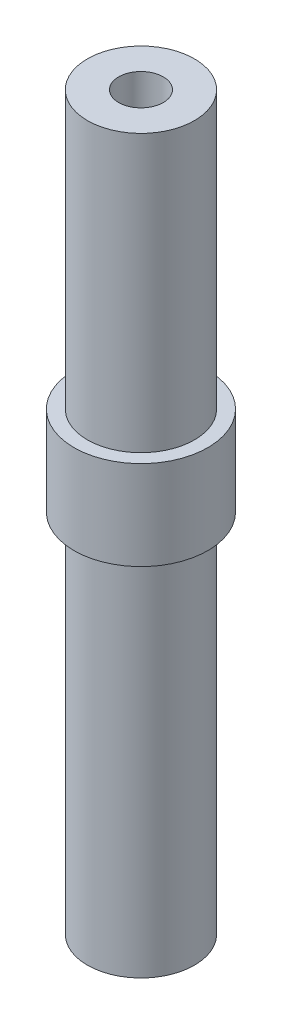
from build123d import *

# Parameters (mm, degrees)
BOSS_EXTRUDE1_DEPTH      = 20.5
BOSS_EXTRUDE1_DEPTH_BACK = 20.5
SKETCH1_R                = 3
SKETCH6_R                = 3.75
BOSS_EXTRUDE2_DEPTH      = 5


with BuildPart() as part:
    # Sketch1 → Boss-Extrude1 (new, two sides: drawn at the far end of the back side and taken through both)
    with BuildSketch(Plane(origin=(0, 0, 0), x_dir=(1, 0, 0), z_dir=(0, 1, 0)).offset(-BOSS_EXTRUDE1_DEPTH_BACK)):
        Circle(SKETCH1_R)
    extrude(amount=BOSS_EXTRUDE1_DEPTH + BOSS_EXTRUDE1_DEPTH_BACK)

    # Sketch5 → M3x0.5 Tapped Hole1 (revolve, cut)
    with BuildSketch(Plane(origin=(0, 20.5, 0), x_dir=(0, 0, 1), z_dir=(1, 0, 0))):
        Polygon((0, 0), (0, 8.751075774), (1.25, 8), (1.25, 0), align=None)
    m3x0_5_tapped_hole1 = revolve(axis=Axis((0, 26.85, 0), (0, -1, 0)), mode=Mode.SUBTRACT)

    # Sketch6 → Boss-Extrude2 (add)
    with BuildSketch(Plane(origin=(0, 0, 0), x_dir=(1, 0, 0), z_dir=(0, 1, 0))):
        Circle(SKETCH6_R)
    extrude(amount=BOSS_EXTRUDE2_DEPTH)

    # Mirror1: M3x0.5 Tapped Hole1 across plane
    add(m3x0_5_tapped_hole1.mirror(Plane.ZX), mode=Mode.SUBTRACT)


solid = part.part
